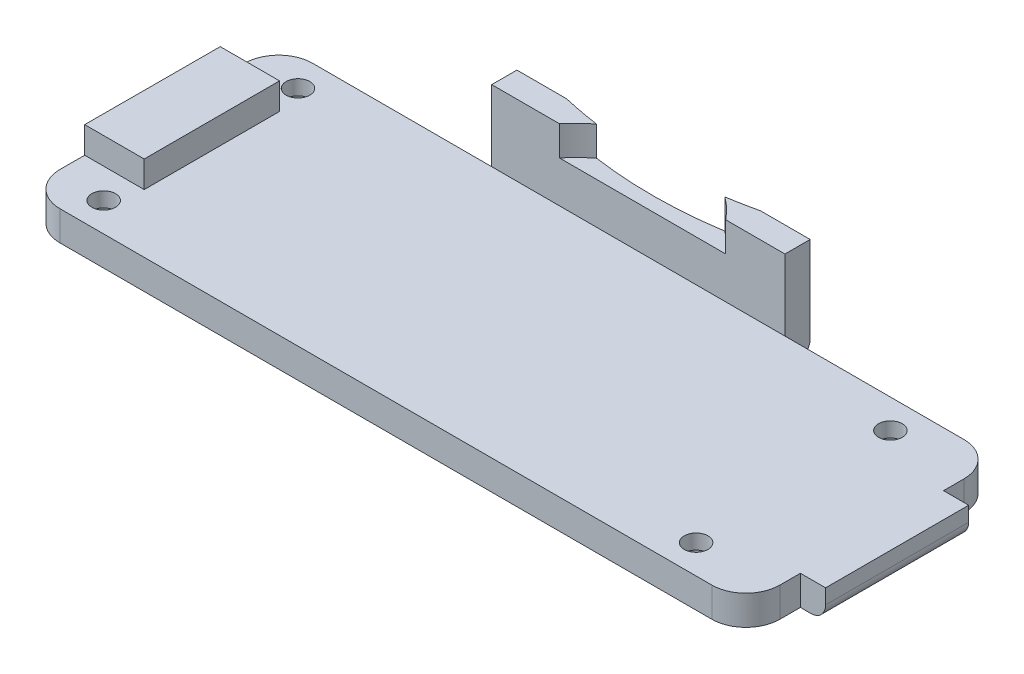
from build123d import *

# Parameters (mm, degrees)
EXTRUDE_1_DEPTH          = 2
SKETCH_3_R               = 1.4
CUT_EXTRUDE_2_DEPTH      = 1
SKETCH_4_R               = 0.8
CUT_EXTRUDE_3_DEPTH      = 7
FILLET_1_R               = 1
EXTRUDE_2_DEPTH          = 1.79
EXTRUDE_3_DEPTH          = 6.8
CUT_EXTRUDE_4_DEPTH      = 2
CUT_EXTRUDE_5_DEPTH      = 9
CUT_EXTRUDE_5_DEPTH_BACK = 5
SKETCH_8_R               = 28.905330341
FILLET_2_R               = 1


with BuildPart() as part:
    # 草图1 → 凸台-拉伸1 (new body)
    with BuildSketch(Plane(origin=(0, 0, 0), x_dir=(1, 0, 0), z_dir=(0, 1, 0))):
        with BuildLine():
            Line((50.296518896, 15.038773117), (51.995638969, 15.038535751))
            Line((51.995638969, 15.038535751), (51.99484152, 5.380301086))
            Line((51.99484152, 5.380301086), (50.29420013, 5.380011427))
            Line((50.29420013, 5.380011427), (50.293979101, 3.999471495))
            ThreePointArc((50.293979101, 3.999471495), (49.619955043, 2.373282378), (47.993458708, 1.700000008))
            Line((47.993458708, 1.700000008), (3.993570964, 1.700000008))
            ThreePointArc((3.993570964, 1.700000008), (2.367381847, 2.374024066), (1.694099477, 4.000520401))
            Line((1.694099477, 4.000520401), (1.718930657, 16.432494262))
            ThreePointArc((1.718930657, 16.432494262), (2.392954716, 18.058683379), (4.01945105, 18.731965749))
            Line((4.01945105, 18.731965749), (47.997365049, 18.71993116))
            ThreePointArc((47.997365049, 18.71993116), (49.623554167, 18.045907101), (50.296836537, 16.419410767))
            Line((50.296836537, 16.419410767), (50.296518896, 15.038773117))
        make_face()
    extrude(amount=EXTRUDE_1_DEPTH)

    # 草图3 → 切除-拉伸2 (cut)
    with BuildSketch(Plane(origin=(0, 0, 0), x_dir=(1, 0, 0), z_dir=(0, 1, 0))):
        with Locations((4.986997661, 16.769823075)):
            Circle(SKETCH_3_R)
        with Locations((4.984007822, 3.657835416)):
            Circle(SKETCH_3_R)
        with Locations((44.986916621, 16.760702161)):
            Circle(SKETCH_3_R)
        with Locations((44.983926782, 3.648714502)):
            Circle(SKETCH_3_R)
    extrude(amount=CUT_EXTRUDE_2_DEPTH, mode=Mode.SUBTRACT)

    # 草图4 → 切除-拉伸3 (cut)
    with BuildSketch(Plane(origin=(0, 2, 0), x_dir=(1, 0, 0), z_dir=(0, 1, 0))):
        with Locations((44.983926782, 3.648714502)):
            Circle(SKETCH_4_R)
        with Locations((44.986916621, 16.760702161)):
            Circle(SKETCH_4_R)
        with Locations((4.984007822, 3.657835416)):
            Circle(SKETCH_4_R)
        with Locations((4.986997661, 16.769823075)):
            Circle(SKETCH_4_R)
    extrude(amount=-CUT_EXTRUDE_3_DEPTH, mode=Mode.SUBTRACT)

    # 圆角1
    fillet_1_edges = [part.edges().sort_by_distance(p)[0] for p in [
        (51.995240244, 0, -10.209418418),
    ]]
    fillet(fillet_1_edges, radius=FILLET_1_R)

    # 草图5 → 凸台-拉伸2 (add)
    with BuildSketch(Plane(origin=(0, 2, 0), x_dir=(1, 0, 0), z_dir=(0, 1, 0))):
        Polygon((1.715661177, 14.795597045), (5.715661177, 14.795597045), (5.715661177, 5.660468281), (1.697415134, 5.660536688), align=None)
    extrude(amount=EXTRUDE_2_DEPTH)


with BuildPart() as extrude_3_tool:
    # 草图6 → 凸台-拉伸3 (new body)
    with BuildSketch(Plane(origin=(0, 0, 0), x_dir=(1, 0, 0), z_dir=(0, 1, 0))):
        Polygon((35.908795328, 20.423234707), (35.908407688, 18.723234749), (16.108408411, 18.72866216), (16.108796051, 20.428662118), align=None)
    extrude(amount=EXTRUDE_3_DEPTH)


with BuildPart() as part_1:
    add(part.part)


with BuildPart() as part_2:
    # 凸台-拉伸3: joined with extrude_3_tool
    add(part_1.part.fuse(extrude_3_tool.part, tol=0.00001))

    # 草图7 → 切除-拉伸4 (cut)
    with BuildSketch(Plane(origin=(0, 6.8, 0), x_dir=(1, 0, 0), z_dir=(0, 1, 0))):
        with BuildLine():
            Line((20.454642354, 18.427468236), (32.137878346, 18.424271109))
            ThreePointArc((32.137878346, 18.424271109), (26.297078845, 21.416891462), (20.454642354, 18.427468236))
        make_face()
    extrude(amount=-CUT_EXTRUDE_4_DEPTH, mode=Mode.SUBTRACT)

    # 草图8 → 切除-拉伸5 (cut, two sides: drawn at the far end of the back side and taken through both)
    with BuildSketch(Plane(origin=(0, 2, 0), x_dir=(1, 0, 0), z_dir=(0, 1, 0)).offset(-CUT_EXTRUDE_5_DEPTH_BACK)):
        with Locations((26.015215658, 48.580825692)):
            Circle(SKETCH_8_R)
    extrude(amount=CUT_EXTRUDE_5_DEPTH + CUT_EXTRUDE_5_DEPTH_BACK, mode=Mode.SUBTRACT)

    # 圆角2
    fillet_2_edges = [part_2.edges().sort_by_distance(p)[0] for p in [
        (34.230033191, 0, -20.423694875),
        (17.786260576, 0, -20.428202305),
        (26.00729237, 0, -19.675496437),
    ]]
    fillet(fillet_2_edges, radius=FILLET_2_R)


solid = part_2.part
